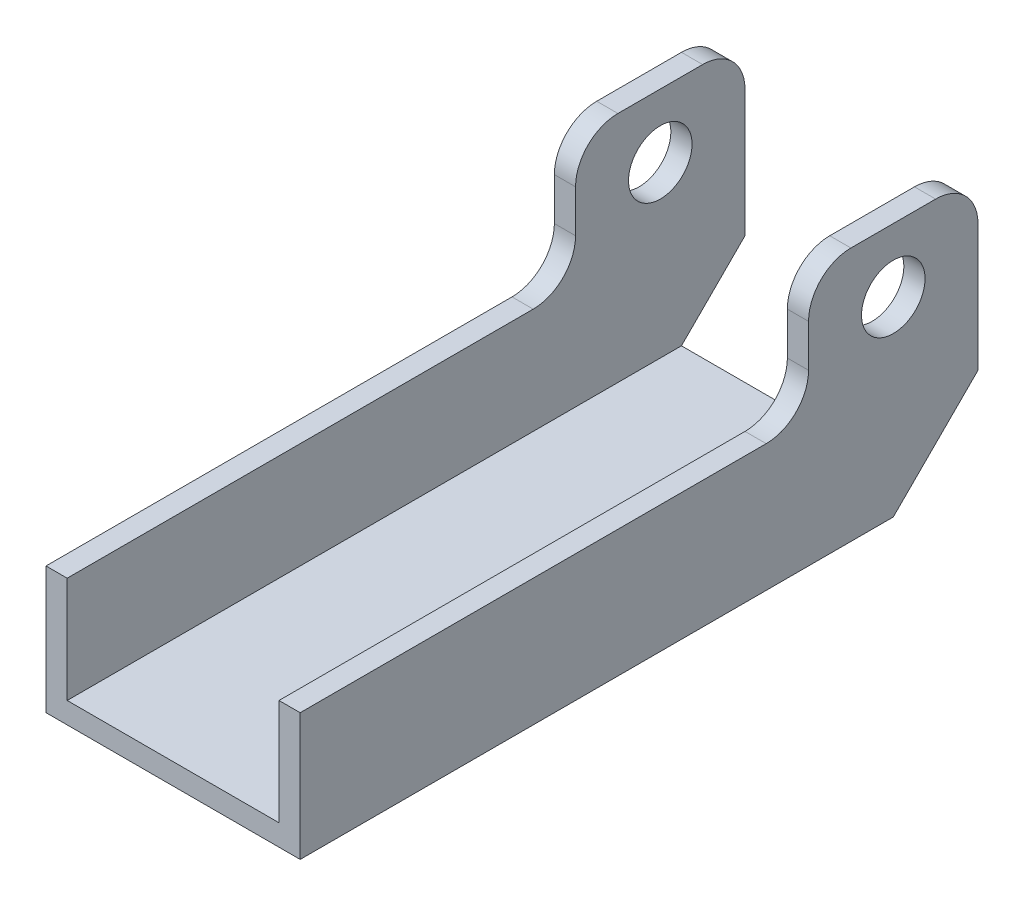
from build123d import *

# Parameters (mm, degrees)
BOSS_EXTRUDE1_DEPTH            = 50.8
SKETCH4_W                      = 1.5875
SKETCH4_H                      = 12.7
BOSS_EXTRUDE2_DEPTH            = 9.525
FILLET2_R                      = 3.175
F_3_16_0_1875_DIAMETER_HOLE1_D = 4.7625
CHAMFER1_SIZE                  = 6.35


with BuildPart() as part:
    # Sketch1 → Boss-Extrude1 (new body)
    with BuildSketch(Plane.XY):
        Polygon((17.4625, 9.525), (17.4625, 1.5875), (1.5875, 1.5875), (1.5875, 9.525), (0, 9.525), (0, 0), (19.05, 0), (19.05, 9.525), align=None)
    extrude(amount=BOSS_EXTRUDE1_DEPTH)

    # Sketch4 → Boss-Extrude2 (add)
    with BuildSketch(Plane(origin=(0, 9.525, 0), x_dir=(1, 0, 0), z_dir=(0, 1, 0))):
        with Locations((0.79375, -6.35)):
            Rectangle(SKETCH4_W, SKETCH4_H)
        with Locations((18.25625, -6.35)):
            Rectangle(SKETCH4_W, SKETCH4_H)
    extrude(amount=BOSS_EXTRUDE2_DEPTH)

    # Fillet2
    fillet2_edges = [part.edges().sort_by_distance(p)[0] for p in [
        (0.79375, 9.525, 12.7),
        (0.79375, 19.05, 12.7),
        (0.79375, 19.05, 0),
        (18.25625, 9.525, 12.7),
        (18.25625, 19.05, 12.7),
        (18.25625, 19.05, 0),
    ]]
    fillet(fillet2_edges, radius=FILLET2_R)

    # 3/16 (0.1875) Diameter Hole1 (through all)
    with Locations(Plane(origin=(19.05, 0, 0), x_dir=(0, 0, -1), z_dir=(1, 0, 0))):
        with Locations((-6.35, 14.2875), (4.115757827, 15.875)):
            Hole(F_3_16_0_1875_DIAMETER_HOLE1_D / 2)

    # Chamfer1
    # the kernel refuses this chamfer: 6.35 mm, written as the material it takes off along each edge
    with BuildSketch(Plane(origin=(-16.330186974, 0, 0), x_dir=(0, 0.9996219169112966, -0.02749587661058637), z_dir=(1, 0, 0))) as chamfer1_piece_1:
        Polygon((CHAMFER1_SIZE * 0.999621916911, CHAMFER1_SIZE * 0.0274958766106), (-CHAMFER1_SIZE * 0.0274958766106, CHAMFER1_SIZE * 0.999621916911), (0, 0), align=None)
    extrude(amount=51.710373947, mode=Mode.SUBTRACT)


solid = part.part
